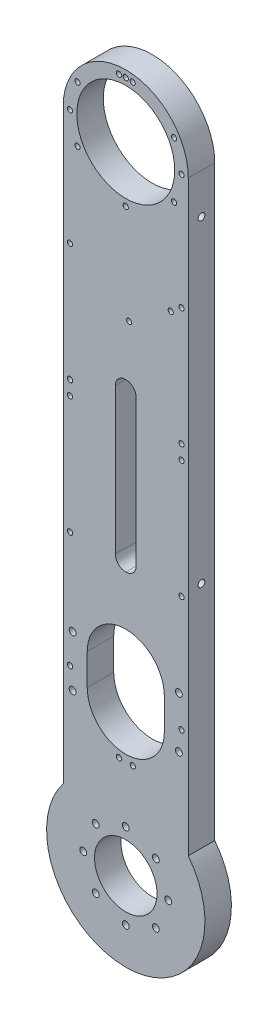
from build123d import *

# Parameters (mm, degrees)
BOSS_EXTRUDE1_DEPTH          = 12.7
CUT_EXTRUDE1_DEPTH           = 338.387447899
HOLE1_D                      = 30
HOLE2_D                      = 47
F_39_0_0995_DIAMETER_HOLE1_D = 2.5273
F_4_CLEARANCE_HOLE1_D        = 3.3
F_2_CLEARANCE_HOLE1_D        = 2.499999999
F_4_CLEARANCE_HOLE2_D        = 3.3
F_4_CLEARANCE_HOLE2_DEPTH    = 10
SKETCH_1_W                   = 10
SKETCH_1_H                   = 80
CUT_EXTRUDE_1_DEPTH          = 338.387447899
FILLET_1_R                   = 5


with BuildPart() as part:
    # Sketch1 → Boss-Extrude1 (new body)
    with BuildSketch(Plane.XY.offset(12.7)):
        with BuildLine():
            Line((-30, 305), (-30, 23.323807579))
            ThreePointArc((-30, 23.323807579), (0, -38), (30, 23.323807579))
            Line((30, 23.323807579), (30, 305))
            ThreePointArc((30, 305), (0, 335), (-30, 305))
        make_face()
    extrude(amount=-BOSS_EXTRUDE1_DEPTH)

    # Sketch2 → Cut-Extrude1 (cut, through all)
    with BuildSketch(Plane(origin=(0, 0, 0), x_dir=(-1, 0, 0), z_dir=(0, 0, -1))):
        with BuildLine():
            Line((18.5, 69.02247107), (18.5, 84.02247107))
            ThreePointArc((18.5, 84.02247107), (0, 102.52247107), (-18.5, 84.02247107))
            Line((-18.5, 84.02247107), (-18.5, 69.02247107))
            ThreePointArc((-18.5, 69.02247107), (0, 50.52247107), (18.5, 69.02247107))
        make_face()
    extrude(amount=-CUT_EXTRUDE1_DEPTH, mode=Mode.SUBTRACT)

    # Hole1 (through all)
    with Locations(Plane.XY.offset(12.7)):
        with Locations((0, 0)):
            Hole(HOLE1_D / 2)

    # Hole2 (through all)
    with Locations(Plane.XY.offset(12.7)):
        with Locations((0, 305)):
            Hole(HOLE2_D / 2)

    # #39 (0.0995) Diameter Hole1 (through all)
    with Locations(Plane.XY.offset(12.7)):
        with Locations((-26.75, 74.022471071), (-26.75, 129.511235535), (-26.75, 186.111235535), (-26.750000001, 192.911235535), (-26.750000001, 249.511235535), (-26.750000001, 305), (-3.300000001, 331.545668196), (3.299999999, 331.545668196), (26.749999999, 305), (26.749999999, 249.511235535), (26.749999999, 192.911235535), (26.75, 186.111235535), (26.75, 129.511235535), (26.75, 74.022471071), (3.4, 47.489425637), (-3.3, 47.476802874), (-23.166179551, 318.375), (-23.166179551, 291.625), (0, 278.25), (23.166179551, 291.625), (23.166179551, 318.375), (0, 331.75)):
            Hole(F_39_0_0995_DIAMETER_HOLE1_D / 2)

    # #4 Clearance Hole1 (through all)
    with Locations(Plane(origin=(0, 0, 0), x_dir=(-1, 0, 0), z_dir=(0, 0, -1))):
        with Locations((-25.5016, 64.272471071), (-25.5016, 88.772471071), (14.424978336, 14.424978336), (20.4, 0), (14.424978336, -14.424978336), (0, -20.4), (-14.424978336, -14.424978336), (-20.4, 0), (-14.424978336, 14.424978336), (0, 20.4), (25.5016, 64.272471071), (25.5016, 88.772471071)):
            Hole(F_4_CLEARANCE_HOLE1_D / 2)

    # #2 Clearance Hole1 (through all)
    with Locations(Plane(origin=(0, 0, 0), x_dir=(-1, 0, 0), z_dir=(0, 0, -1))):
        with Locations((-1.619921459, 231.265288591), (-21.578861519, 245.43367635)):
            Hole(F_2_CLEARANCE_HOLE1_D / 2)

    # #4 Clearance Hole2
    with Locations(Plane(origin=(30, 0, 0), x_dir=(0, 0, -1), z_dir=(1, 0, 0))):
        with Locations((-6.35, 285.723807579), (-6.35, 133.323807579)):
            Hole(F_4_CLEARANCE_HOLE2_D / 2, depth=F_4_CLEARANCE_HOLE2_DEPTH)

    # 草图1 → 切除-拉伸1 (cut, through all)
    with BuildSketch(Plane(origin=(0, 0, 0), x_dir=(-1, 0, 0), z_dir=(0, 0, -1))):
        with Locations((0, 166.265288591)):
            Rectangle(SKETCH_1_W, SKETCH_1_H)
    extrude(amount=-CUT_EXTRUDE_1_DEPTH, mode=Mode.SUBTRACT)

    # 圆角1
    fillet_1_edges = [part.edges().sort_by_distance(p)[0] for p in [
        (-5, 126.265288591, 6.35),
        (5, 126.265288591, 6.35),
        (-5, 206.265288591, 6.35),
        (5, 206.265288591, 6.35),
    ]]
    fillet(fillet_1_edges, radius=FILLET_1_R - 0.0001)  # a hair under: the kernel refuses the full size


solid = part.part
